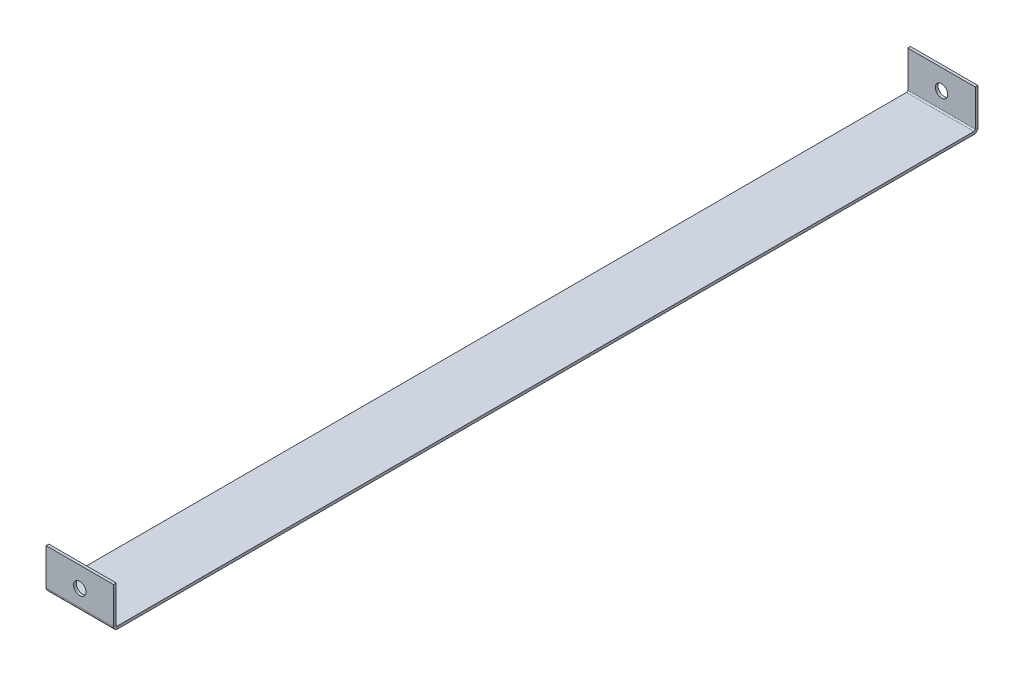
from build123d import *

# Parameters (mm, degrees)
BASEFLANGE_W                   = 50
BASEFLANGE_H                   = 640
BASE_FLANGE1_DEPTH             = 2
EDGE_FLANGE1_STRIP_W           = 10
EDGE_FLANGE1_STRIP_H           = 2
EDGE_FLANGE1_STRIP_CUT_DEPTH   = 50
EDGE_FLANGE1_STRIP_2_W         = 10
EDGE_FLANGE1_STRIP_2_H         = 2
EDGE_FLANGE1_STRIP_CUT_2_DEPTH = 50
EDGE_FLANGE1_DEPTH             = 50
EDGE_FLANGE1_BEND_DEPTH        = 50
SKETCH8_R                      = 4.6
EXTRUDE1_DEPTH                 = 642.190299365


# Sheet-metal steps are written as plain solids
with BuildPart() as part:
    # BaseFlange → Base-Flange1 (new body)
    with BuildSketch(Plane(origin=(0, 0, 0), x_dir=(1, 0, 0), z_dir=(0, 1, 0))):
        Rectangle(BASEFLANGE_W, BASEFLANGE_H)
    extrude(amount=BASE_FLANGE1_DEPTH)

    # Edge-Flange1 strip (across the edge) → Edge-Flange1 strip cut (cut)
    with BuildSketch(Plane(origin=(-25, 2, 320), x_dir=(0, 0, -1), z_dir=(1, 0, 0))):
        with Locations((-2, -1)):
            Rectangle(EDGE_FLANGE1_STRIP_W, EDGE_FLANGE1_STRIP_H)
    extrude(amount=EDGE_FLANGE1_STRIP_CUT_DEPTH, mode=Mode.SUBTRACT)

    # Edge-Flange1 strip 2 (across the edge) → Edge-Flange1 strip cut 2 (cut)
    with BuildSketch(Plane(origin=(25, 2, -320), x_dir=(0, 0, 1), z_dir=(-1, 0, 0))):
        with Locations((-2, -1)):
            Rectangle(EDGE_FLANGE1_STRIP_2_W, EDGE_FLANGE1_STRIP_2_H)
    extrude(amount=EDGE_FLANGE1_STRIP_CUT_2_DEPTH, mode=Mode.SUBTRACT)

    # Edge-Flange1 section (across the edge) → Edge-Flange1 (add)
    with BuildSketch(Plane(origin=(-25, 2, 320), x_dir=(0, 0, -1), z_dir=(1, 0, 0))):
        with BuildLine():
            Line((0, 1), (0, 28))
            Line((0, 28), (2, 28))
            Line((2, 28), (2, 1))
            ThreePointArc((2, 1), (2.292893219, 0.292893219), (3, 0))
            Line((3, 0), (3, -2))
            ThreePointArc((3, -2), (0.878679656, -1.121320344), (0, 1))
        make_face()
    extrude(amount=EDGE_FLANGE1_DEPTH)

    # Edge-Flange1 section 2 (across the edge) → Edge-Flange1 bend (add)
    with BuildSketch(Plane(origin=(25, 2, -320), x_dir=(0, 0, 1), z_dir=(-1, 0, 0))):
        with BuildLine():
            Line((0, 1), (0, 28))
            Line((0, 28), (2, 28))
            Line((2, 28), (2, 1))
            ThreePointArc((2, 1), (2.292893219, 0.292893219), (3, 0))
            Line((3, 0), (3, -2))
            ThreePointArc((3, -2), (0.878679656, -1.121320344), (0, 1))
        make_face()
    extrude(amount=EDGE_FLANGE1_BEND_DEPTH)

    # Sketch8 → Extrude1 (cut, through all)
    with BuildSketch(Plane.XY.offset(320)):
        with Locations((0, 15)):
            Circle(SKETCH8_R)
    extrude(amount=-EXTRUDE1_DEPTH, mode=Mode.SUBTRACT)


solid = part.part
